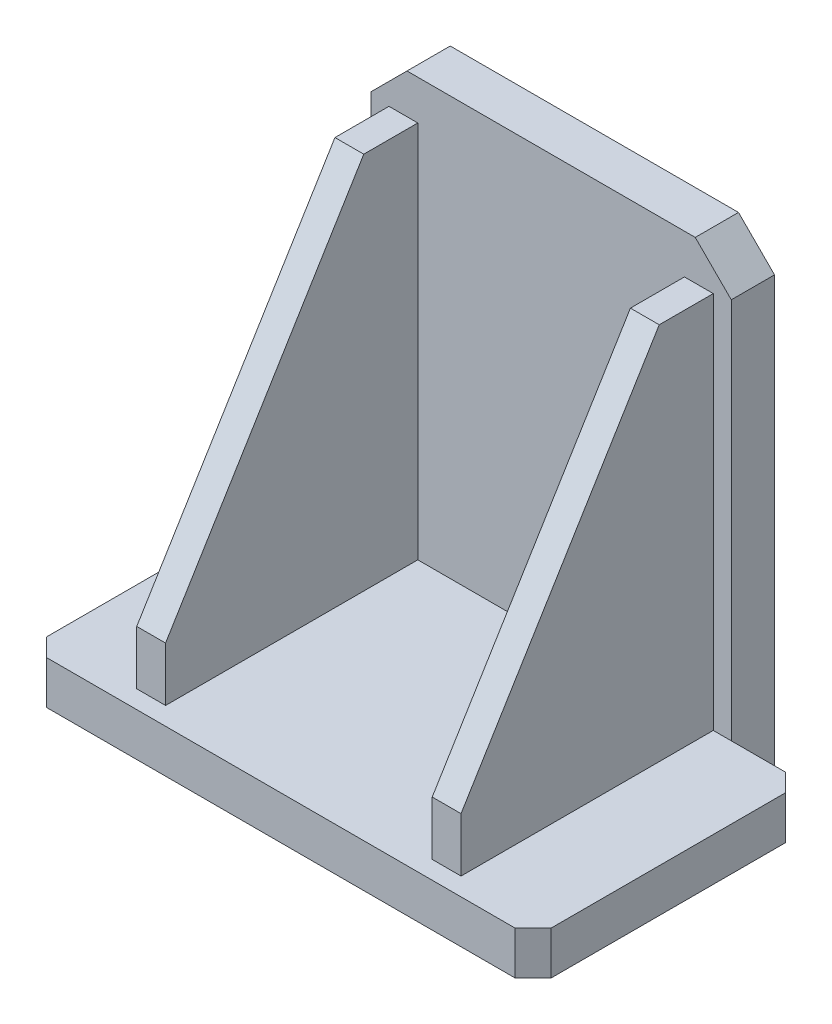
from build123d import *

# Parameters (mm, degrees)
SKETCH1_W           = 140
SKETCH1_H           = 75
BOSS_EXTRUDE4_DEPTH = 12
SKETCH5_W           = 100
SKETCH5_H           = 12
BOSS_EXTRUDE5_DEPTH = 128
GUSSET1_START       = 107
GUSSET1_DEPTH       = 8
GUSSET2_START       = 25
GUSSET2_DEPTH       = 8
CHAMFER1_SIZE       = 10
CHAMFER2_SIZE       = 5


# Read off the part's stored shape, not the designer's step: Gusset1, Gusset2
with BuildPart() as part:
    # Sketch1 → Boss-Extrude4 (new body)
    with BuildSketch(Plane(origin=(0, 0, 0), x_dir=(1, 0, 0), z_dir=(0, 1, 0))):
        with Locations((70, 37.5)):
            Rectangle(SKETCH1_W, SKETCH1_H)
    extrude(amount=BOSS_EXTRUDE4_DEPTH)

    # Sketch5 → Boss-Extrude5 (add)
    with BuildSketch(Plane(origin=(0, 0, 0), x_dir=(1, 0, 0), z_dir=(0, 1, 0))):
        with Locations((70, 81)):
            Rectangle(SKETCH5_W, SKETCH5_H)
    extrude(amount=BOSS_EXTRUDE5_DEPTH)

    # Chamfer1
    chamfer1_edges = [part.edges().sort_by_distance(p)[0] for p in [
        (20, 128, -81),
        (120, 128, -81),
    ]]
    chamfer(chamfer1_edges, length=CHAMFER1_SIZE)

    # Chamfer2
    chamfer2_edges = [part.edges().sort_by_distance(p)[0] for p in [
        (0, 6, -75),
        (140, 6, -75),
        (140, 6, 0),
        (0, 6, 0),
    ]]
    chamfer(chamfer2_edges, length=CHAMFER2_SIZE)


with BuildPart() as body_2:
    # Gusset1 outline → Gusset1 (new body)
    with BuildSketch(Plane.YZ.offset(GUSSET1_START)):
        Polygon((117, -75), (117, -60), (27, -5), (12, -5), (12, -75), align=None)
    extrude(amount=GUSSET1_DEPTH)


with BuildPart() as body_3:
    # Gusset2 outline → Gusset2 (new body)
    with BuildSketch(Plane.YZ.offset(GUSSET2_START)):
        Polygon((117, -75), (117, -60), (27, -5), (12, -5), (12, -75), align=None)
    extrude(amount=GUSSET2_DEPTH)


solid = Compound([part.part, body_2.part, body_3.part])
